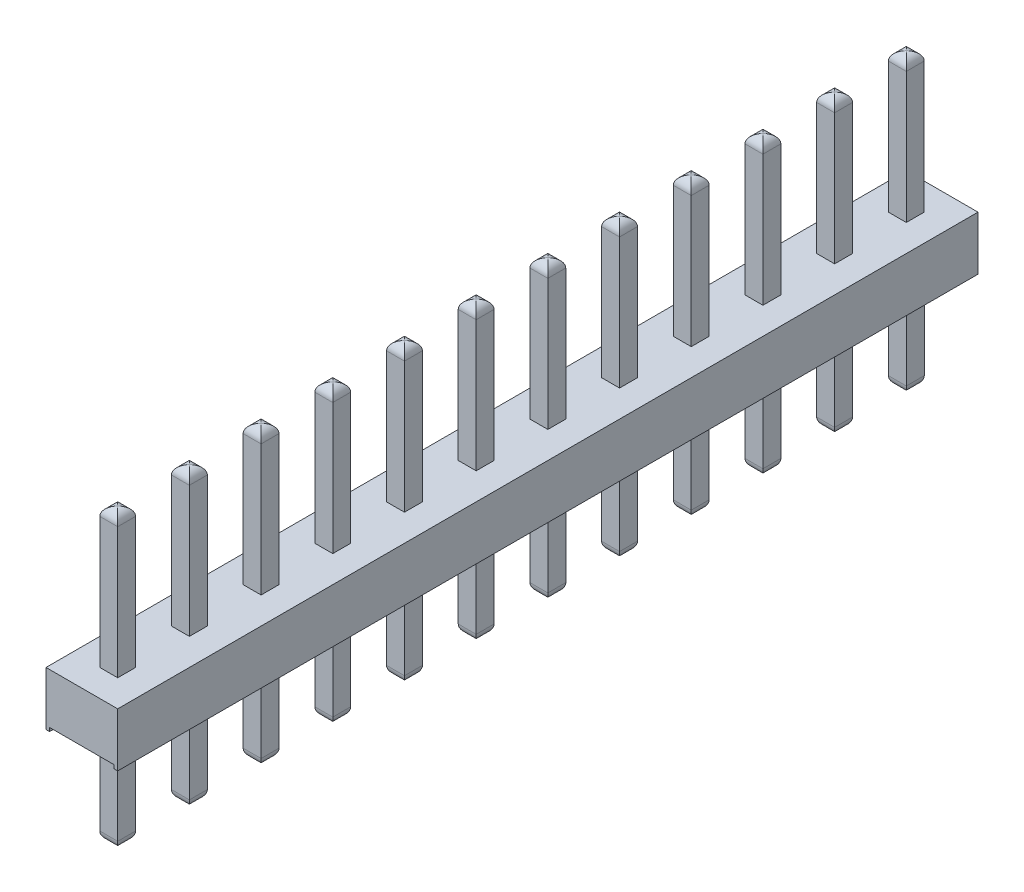
from build123d import *

# Parameters (mm, degrees)
BOSS_EXTRUDE1_DEPTH = 24
BOSS_EXTRUDE2_DEPTH = 3.9
FILLET1_R           = 0.25
SKETCH3_W           = 0.5
SKETCH3_H           = 0.501157684
BOSS_EXTRUDE3_DEPTH = 2.8
FILLET2_R           = 0.25


with BuildPart() as part:
    # Sketch1 → Boss-Extrude1 (new body)
    with BuildSketch(Plane.XY):
        Polygon((0.1, -1.5), (0.1, -1.399682434), (1.901861327, -1.399682434), (1.901861327, -1.5), (2, -1.5), (2, 0), (0, 0), (0, -1.5), align=None)
    extrude(amount=-BOSS_EXTRUDE1_DEPTH)

    # Sketch2 → Boss-Extrude2 (add)
    with BuildSketch(Plane(origin=(0, 0, 0), x_dir=(1, 0, 0), z_dir=(0, 1, 0))):
        Polygon((1, 23.25), (0.75, 23.25), (0.75, 22.75), (1, 22.75), (1.25, 22.75), (1.25, 23.25), align=None)
        Polygon((0.75, 20.75), (1, 20.75), (1.25, 20.75), (1.25, 21.25), (1, 21.25), (0.75, 21.25), align=None)
        Polygon((0.75, 18.75), (1, 18.75), (1.25, 18.75), (1.25, 19.25), (1, 19.25), (0.75, 19.25), align=None)
        Polygon((0.75, 16.75), (1, 16.75), (1.25, 16.75), (1.25, 17.25), (1, 17.25), (0.75, 17.25), align=None)
        Polygon((0.75, 14.75), (1, 14.75), (1.25, 14.75), (1.25, 15.25), (1, 15.25), (0.75, 15.25), align=None)
        Polygon((0.75, 12.75), (1, 12.75), (1.25, 12.75), (1.25, 13.25), (1, 13.25), (0.75, 13.25), align=None)
        Polygon((0.75, 10.75), (1, 10.75), (1.25, 10.75), (1.25, 11.25), (1, 11.25), (0.75, 11.25), align=None)
        Polygon((0.75, 8.75), (1, 8.75), (1.25, 8.75), (1.25, 9.25), (1, 9.25), (0.75, 9.25), align=None)
        Polygon((0.75, 6.75), (1, 6.75), (1.25, 6.75), (1.25, 7.25), (1, 7.25), (0.75, 7.25), align=None)
        Polygon((0.75, 4.75), (1, 4.75), (1.25, 4.75), (1.25, 5.25), (1, 5.25), (0.75, 5.25), align=None)
        Polygon((0.75, 2.75), (1, 2.75), (1.25, 2.75), (1.25, 3.25), (1, 3.25), (0.75, 3.25), align=None)
        Polygon((0.75, 0.75), (1, 0.75), (1.25, 0.75), (1.25, 1.25), (1, 1.25), (0.75, 1.25), align=None)
    extrude(amount=BOSS_EXTRUDE2_DEPTH)

    # Fillet1
    fillet1_edges = [part.edges().sort_by_distance(p)[0] for p in [
        (1.25, 3.9, -11),
        (1, 3.9, -9.25),
        (0.75, 3.9, -9),
        (1, 3.9, -8.75),
        (1.25, 3.9, -9),
        (1, 3.9, -7.25),
        (0.75, 3.9, -7),
        (1, 3.9, -6.75),
        (1.25, 3.9, -7),
        (1, 3.9, -5.25),
        (0.75, 3.9, -5),
        (1, 3.9, -4.75),
        (1.25, 3.9, -5),
        (1, 3.9, -3.25),
        (0.75, 3.9, -3),
        (1, 3.9, -2.75),
        (1.25, 3.9, -3),
        (1, 3.9, -1.25),
        (0.75, 3.9, -1),
        (1, 3.9, -0.75),
        (1.25, 3.9, -1),
        (1, 3.9, -23.25),
        (0.75, 3.9, -23),
        (1, 3.9, -22.75),
        (1.25, 3.9, -23),
        (1, 3.9, -21.25),
        (0.75, 3.9, -21),
        (1, 3.9, -20.75),
        (1.25, 3.9, -21),
        (1, 3.9, -19.25),
        (0.75, 3.9, -19),
        (1, 3.9, -18.75),
        (1.25, 3.9, -19),
        (1, 3.9, -17.25),
        (0.75, 3.9, -17),
        (1, 3.9, -16.75),
        (1.25, 3.9, -17),
        (1, 3.9, -15.25),
        (0.75, 3.9, -15),
        (1, 3.9, -14.75),
        (1.25, 3.9, -15),
        (1, 3.9, -13.25),
        (0.75, 3.9, -13),
        (1, 3.9, -12.75),
        (1.25, 3.9, -13),
        (1, 3.9, -11.25),
        (0.75, 3.9, -11),
        (1, 3.9, -10.75),
    ]]
    fillet(fillet1_edges, radius=FILLET1_R - 0.0001)  # a hair under: the kernel refuses the full size

    # Sketch3 → Boss-Extrude3 (add)
    with BuildSketch(Plane(origin=(0, -1.399682434, 0), x_dir=(-1, 0, 0), z_dir=(0, -1, 0))):
        with Locations((-1.000930663, 21)):
            Rectangle(SKETCH3_W, SKETCH3_H)
        with Locations((-1.000930663, 23)):
            Rectangle(SKETCH3_W, SKETCH3_H)
        with Locations((-1.000930663, 19)):
            Rectangle(SKETCH3_W, SKETCH3_H)
        with Locations((-1.000930663, 17)):
            Rectangle(SKETCH3_W, SKETCH3_H)
        with Locations((-1.000930663, 15)):
            Rectangle(SKETCH3_W, SKETCH3_H)
        with Locations((-1.000930663, 13)):
            Rectangle(SKETCH3_W, SKETCH3_H)
        with Locations((-1.000930663, 11)):
            Rectangle(SKETCH3_W, SKETCH3_H)
        with Locations((-1.000930663, 9)):
            Rectangle(SKETCH3_W, SKETCH3_H)
        with Locations((-1.000930663, 7)):
            Rectangle(SKETCH3_W, SKETCH3_H)
        with Locations((-1.000930663, 5)):
            Rectangle(SKETCH3_W, SKETCH3_H)
        with Locations((-1.000930663, 3)):
            Rectangle(SKETCH3_W, SKETCH3_H)
        with Locations((-1.000930663, 1)):
            Rectangle(SKETCH3_W, SKETCH3_H)
    extrude(amount=BOSS_EXTRUDE3_DEPTH)

    # Fillet2
    fillet2_edges = [part.edges().sort_by_distance(p)[0] for p in [
        (1.000930663, -4.199682434, -23.250578842),
        (0.750930663, -4.199682434, -23),
        (1.250930663, -4.199682434, -23),
        (1.000930663, -4.199682434, -22.749421158),
        (1.000930663, -4.199682434, -21.250578842),
        (0.750930663, -4.199682434, -21),
        (1.250930663, -4.199682434, -21),
        (1.000930663, -4.199682434, -20.749421158),
        (1.000930663, -4.199682434, -19.250578842),
        (0.750930663, -4.199682434, -19),
        (1.250930663, -4.199682434, -19),
        (1.000930663, -4.199682434, -18.749421158),
        (1.000930663, -4.199682434, -17.250578842),
        (0.750930663, -4.199682434, -17),
        (1.250930663, -4.199682434, -17),
        (1.000930663, -4.199682434, -16.749421158),
        (1.000930663, -4.199682434, -15.250578842),
        (0.750930663, -4.199682434, -15),
        (1.250930663, -4.199682434, -15),
        (1.000930663, -4.199682434, -14.749421158),
        (1.000930663, -4.199682434, -13.250578842),
        (0.750930663, -4.199682434, -13),
        (1.250930663, -4.199682434, -13),
        (1.000930663, -4.199682434, -12.749421158),
        (1.000930663, -4.199682434, -11.250578842),
        (0.750930663, -4.199682434, -11),
        (1.250930663, -4.199682434, -11),
        (1.000930663, -4.199682434, -10.749421158),
        (1.000930663, -4.199682434, -9.250578842),
        (0.750930663, -4.199682434, -9),
        (1.250930663, -4.199682434, -9),
        (1.000930663, -4.199682434, -8.749421158),
        (1.000930663, -4.199682434, -7.250578842),
        (0.750930663, -4.199682434, -7),
        (1.250930663, -4.199682434, -7),
        (1.000930663, -4.199682434, -6.749421158),
        (1.000930663, -4.199682434, -5.250578842),
        (0.750930663, -4.199682434, -5),
        (1.250930663, -4.199682434, -5),
        (1.000930663, -4.199682434, -4.749421158),
        (1.000930663, -4.199682434, -3.250578842),
        (0.750930663, -4.199682434, -3),
        (1.250930663, -4.199682434, -3),
        (1.000930663, -4.199682434, -2.749421158),
        (1.000930663, -4.199682434, -1.250578842),
        (0.750930663, -4.199682434, -1),
        (1.250930663, -4.199682434, -1),
        (1.000930663, -4.199682434, -0.749421158),
    ]]
    fillet(fillet2_edges, radius=FILLET2_R - 0.0001)  # a hair under: the kernel refuses the full size


solid = part.part
